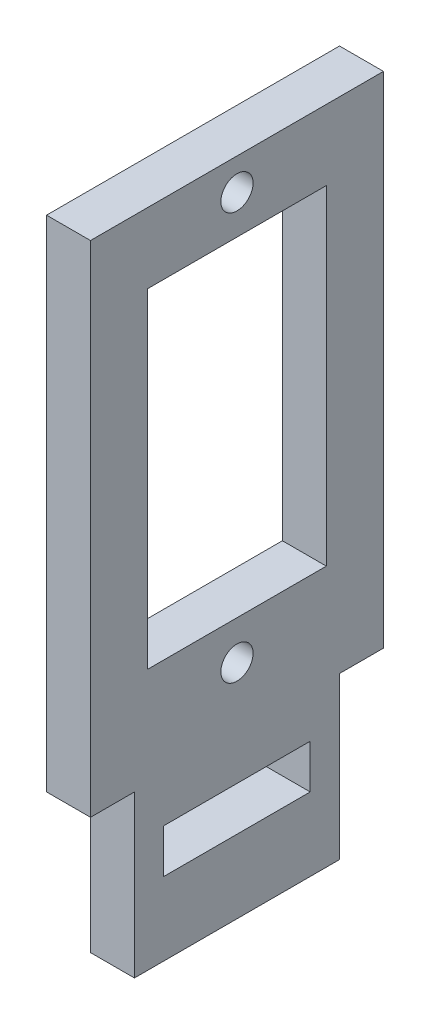
from build123d import *

# Parameters (mm, degrees)
SKETCH1_W           = 20
SKETCH1_H           = 45.1
SKETCH1_W_2         = 10
SKETCH1_H_2         = 3
BOSS_EXTRUDE1_DEPTH = 3
SKETCH2_R           = 1.1
SKETCH2_W           = 12.2
SKETCH2_H           = 22.5
SKETCH2_W_2         = 3
SKETCH2_H_2         = 11
CUT_EXTRUDE1_DEPTH  = 3


with BuildPart() as part:
    # Sketch1 → Boss-Extrude1 (new body)
    with BuildSketch(Plane(origin=(0, 0, 0), x_dir=(0, 0, -1), z_dir=(1, 0, 0))):
        with Locations((10, 22.55)):
            Rectangle(SKETCH1_W, SKETCH1_H)
        with Locations((10, 6.5)):
            Rectangle(SKETCH1_W_2, SKETCH1_H_2, mode=Mode.SUBTRACT)
    extrude(amount=BOSS_EXTRUDE1_DEPTH)

    # Sketch2 → Cut-Extrude1 (cut)
    with BuildSketch(Plane.ZY):
        with Locations((-10, 42.95)):
            Circle(SKETCH2_R)
        with Locations((-10, 15.15)):
            Circle(SKETCH2_R)
        with Locations((-10, 29.05)):
            Rectangle(SKETCH2_W, SKETCH2_H)
        with Locations((-18.5, 5.5)):
            Rectangle(SKETCH2_W_2, SKETCH2_H_2)
        with Locations((-1.5, 5.5)):
            Rectangle(SKETCH2_W_2, SKETCH2_H_2)
    extrude(amount=-CUT_EXTRUDE1_DEPTH, mode=Mode.SUBTRACT)


solid = part.part
